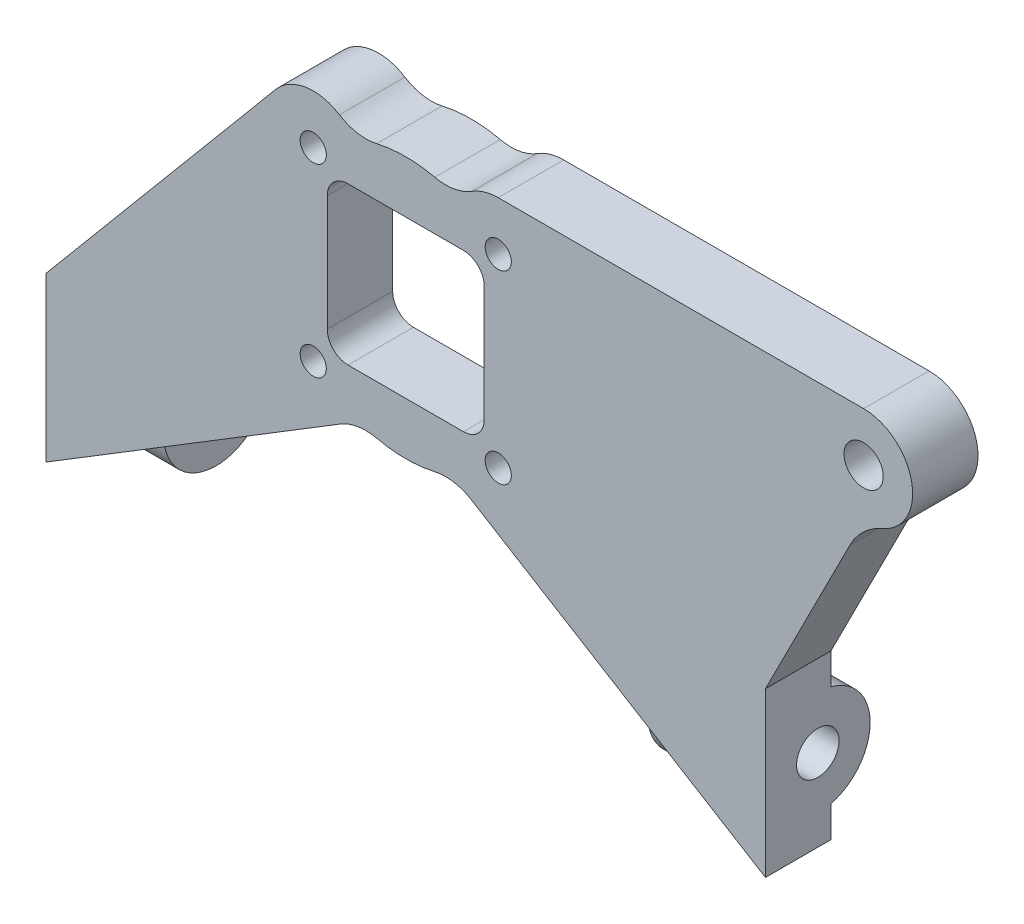
from build123d import *

# Parameters (mm, degrees)
SKETCH1_R           = 2
SKETCH1_R_2         = 3
BOSS_EXTRUDE1_DEPTH = 10
FILLET1_R           = 10
SKETCH2_R           = 8
BOSS_EXTRUDE4_DEPTH = 18
CUT_EXTRUDE3_REACH  = 106.222
SKETCH5_R           = 5
CUT_EXTRUDE4_REACH  = 106.222
SKETCH6_R           = 3.25


with BuildPart() as part:
    # Sketch1 → Boss-Extrude1 (new body)
    with BuildSketch(Plane.XY):
        with BuildLine():
            Line((-54.999994677, -47.940227132), (-10.227120132, -20.539217279))
            ThreePointArc((-10.227120132, -20.539217279), (-10.177124793, -20.508350285), (-10.127372804, -20.477092569))
            ThreePointArc((-10.127372804, -20.477092569), (-7.384123474, -19.420618432), (-4.445534534, -19.499672374))
            ThreePointArc((-4.445534534, -19.499672374), (0, -20), (4.445534534, -19.499672374))
            ThreePointArc((4.445534534, -19.499672374), (7.384123474, -19.420618432), (10.127372804, -20.477092569))
            ThreePointArc((10.127372804, -20.477092569), (10.177124779, -20.508350276), (10.227120104, -20.539217262))
            Line((10.227120104, -20.539217262), (54.999994677, -47.940227397))
            Line((54.999994677, -47.940227397), (54.999994677, -22.940227397))
            Line((54.999994677, -22.940227397), (69.999984325, 6.642135624))
            ThreePointArc((69.999984325, 6.642135624), (77.499984325, 14.142135624), (69.999984325, 21.642135624))
            Line((69.999984325, 21.642135624), (14.142135624, 21.642135624))
            ThreePointArc((14.142135624, 21.642135624), (12.051941505, 21.34498843), (10.127372804, 20.477092569))
            ThreePointArc((10.127372804, 20.477092569), (7.384123474, 19.420618432), (4.445534534, 19.499672374))
            ThreePointArc((4.445534534, 19.499672374), (0, 20), (-4.445534534, 19.499672374))
            ThreePointArc((-4.445534534, 19.499672374), (-7.384123474, 19.420618432), (-10.127372804, 20.477092569))
            ThreePointArc((-10.127372804, 20.477092569), (-15.294351568, 21.553100367), (-19.890743526, 18.959137512))
            Line((-19.890743526, 18.959137512), (-54.999994677, -22.940227132))
            Line((-54.999994677, -22.940227132), (-54.999994677, -47.940227132))
        make_face()
        with BuildLine():
            Line((12, 8.825), (12, -8.825))
            ThreePointArc((12, -8.825), (11.07006403, -11.07006403), (8.825, -12))
            Line((8.825, -12), (-8.825, -12))
            ThreePointArc((-8.825, -12), (-11.07006403, -11.07006403), (-12, -8.825))
            Line((-12, -8.825), (-12, 8.825))
            ThreePointArc((-12, 8.825), (-11.07006403, 11.07006403), (-8.825, 12))
            Line((-8.825, 12), (8.825, 12))
            ThreePointArc((8.825, 12), (11.07006403, 11.07006403), (12, 8.825))
        make_face(mode=Mode.SUBTRACT)
        with Locations((-14.142135624, 14.142135624)):
            Circle(SKETCH1_R, mode=Mode.SUBTRACT)
        with Locations((14.142135624, -14.142135624)):
            Circle(SKETCH1_R, mode=Mode.SUBTRACT)
        with Locations((14.142135624, 14.142135624)):
            Circle(SKETCH1_R, mode=Mode.SUBTRACT)
        with Locations((-14.142135624, -14.142135624)):
            Circle(SKETCH1_R, mode=Mode.SUBTRACT)
        with Locations((69.999984325, 14.142135624)):
            Circle(SKETCH1_R_2, mode=Mode.SUBTRACT)
    extrude(amount=BOSS_EXTRUDE1_DEPTH)

    # Fillet1
    fillet1_edges = [part.edges().sort_by_distance(p)[0] for p in [
        (69.999984325, 6.642135624, 5),
    ]]
    fillet(fillet1_edges, radius=FILLET1_R)

    # Sketch2 → Boss-Extrude4 (add)
    with BuildSketch(Plane(origin=(54.999994677, 0, 0), x_dir=(0, 0, -1), z_dir=(1, 0, 0))):
        with Locations((-2, -35.440227397)):
            Circle(SKETCH2_R)
    boss_extrude4 = extrude(amount=-BOSS_EXTRUDE4_DEPTH)

    # Sketch5 → Cut-Extrude3 (cut, up to next)
    with BuildSketch(Plane.ZY.offset(-36.999994677), mode=Mode.PRIVATE) as cut_extrude3_sk1:
        with Locations((2, -35.440227397)):
            Circle(SKETCH5_R)
    cut_extrude3_tool1 = extrude(cut_extrude3_sk1.sketch, amount=CUT_EXTRUDE3_REACH, mode=Mode.PRIVATE) & part.part
    cut_extrude3 = cut_extrude3_tool1.solids().sort_by_distance((36.999995, -35.440227, 2))[0]
    add(cut_extrude3, mode=Mode.SUBTRACT)

    # Sketch6 → Cut-Extrude4 (cut, up to next)
    with BuildSketch(Plane.ZY.offset(-36.999994677), mode=Mode.PRIVATE) as cut_extrude4_sk1:
        with Locations((2, -35.440227397)):
            Circle(SKETCH6_R)
    cut_extrude4_tool1 = extrude(cut_extrude4_sk1.sketch, amount=-CUT_EXTRUDE4_REACH, mode=Mode.PRIVATE) & part.part
    cut_extrude4 = cut_extrude4_tool1.solids().sort_by_distance((36.999995, -35.440227, 2))[0]
    add(cut_extrude4, mode=Mode.SUBTRACT)

    # Mirror2: Boss-Extrude4, Cut-Extrude3, Cut-Extrude4 across plane
    add(boss_extrude4.mirror(Plane(origin=(0, 0, 0), x_dir=(0, 0, 1), z_dir=(1, 0, 0))))
    add(cut_extrude3.mirror(Plane(origin=(0, 0, 0), x_dir=(0, 0, 1), z_dir=(1, 0, 0))), mode=Mode.SUBTRACT)
    add(cut_extrude4.mirror(Plane(origin=(0, 0, 0), x_dir=(0, 0, 1), z_dir=(1, 0, 0))), mode=Mode.SUBTRACT)


solid = part.part
